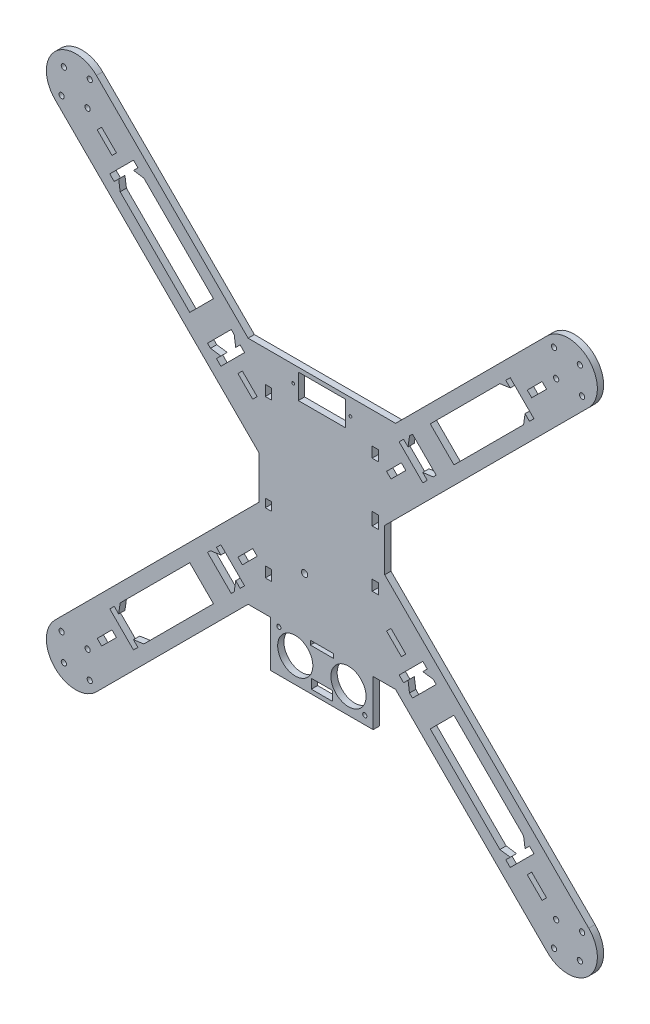
from build123d import *

# Parameters (mm, degrees)
BOSS_EXTRUDE1_DEPTH = 3
SKETCH4_R           = 1.25
CUT_EXTRUDE1_DEPTH  = 3
SKETCH5_R           = 0.65
SKETCH5_W           = 22.5
SKETCH5_H           = 11.8
CUT_EXTRUDE2_DEPTH  = 3
SKETCH6_R           = 1.5
CUT_EXTRUDE3_DEPTH  = 3
SKETCH7_R           = 1
SKETCH7_R_2         = 8.4
SKETCH7_W           = 11
SKETCH7_H           = 2
SKETCH7_W_2         = 10
SKETCH7_H_2         = 4.5
CUT_EXTRUDE4_DEPTH  = 3
CUT_EXTRUDE5_DEPTH  = 186.993279448
BOSS_EXTRUDE2_REACH = 195.992
SKETCH9_W           = 3
SKETCH9_H           = 12
BOSS_EXTRUDE3_REACH = 195.992
SKETCH11_W          = 3
SKETCH11_H          = 12
BOSS_EXTRUDE4_REACH = 195.992
SKETCH12_W          = 3
SKETCH12_H          = 12
BOSS_EXTRUDE5_REACH = 195.992
SKETCH13_W          = 3
SKETCH13_H          = 12
SKETCH14_W          = 3
SKETCH14_H          = 6
SKETCH14_H_2        = 5
SKETCH14_H_3        = 4
CUT_EXTRUDE6_DEPTH  = 186.993279448


with BuildPart() as part:
    # Sketch1 → Boss-Extrude1 (new body)
    with BuildSketch(Plane.XY):
        with BuildLine():
            Line((35.201010127, 55), (-35.201010127, 55))
            Line((-35.201010127, 55), (-107.600505063, 127.399494937))
            ThreePointArc((-107.600505063, 127.399494937), (-127.399494937, 127.399494937), (-127.399494937, 107.600505063))
            Line((-127.399494937, 107.600505063), (-30, 10.201010127))
            Line((-30, 10.201010127), (-30, -10.201010127))
            Line((-30, -10.201010127), (-127.399494937, -107.600505063))
            ThreePointArc((-127.399494937, -107.600505063), (-127.399494937, -127.399494937), (-107.600505063, -127.399494937))
            Line((-107.600505063, -127.399494937), (-35.201010127, -55))
            Line((-35.201010127, -55), (-24.5, -55))
            Line((-24.5, -55), (-24.5, -77))
            Line((-24.5, -77), (24.5, -77))
            Line((24.5, -77), (24.5, -55))
            Line((24.5, -55), (35.201010127, -55))
            Line((35.201010127, -55), (107.600505063, -127.399494937))
            ThreePointArc((107.600505063, -127.399494937), (127.399494937, -127.399494937), (127.399494937, -107.600505063))
            Line((127.399494937, -107.600505063), (30, -10.201010127))
            Line((30, -10.201010127), (30, 10.201010127))
            Line((30, 10.201010127), (127.399494937, 107.600505063))
            ThreePointArc((127.399494937, 107.600505063), (127.399494937, 127.399494937), (107.600505063, 127.399494937))
            Line((107.600505063, 127.399494937), (35.201010127, 55))
        make_face()
    extrude(amount=-BOSS_EXTRUDE1_DEPTH)

    # Sketch4 → Cut-Extrude1 (cut)
    with BuildSketch(Plane.XY):
        with Locations((-110.782485579, 124.217514421)):
            Circle(SKETCH4_R)
        with Locations((-124.217514421, 110.782485579)):
            Circle(SKETCH4_R)
        with Locations((-123.156854249, 123.156854249)):
            Circle(SKETCH4_R)
        with Locations((-111.843145751, 111.843145751)):
            Circle(SKETCH4_R)
        with Locations((111.843145751, 111.843145751)):
            Circle(SKETCH4_R)
        with Locations((110.782485579, 124.217514421)):
            Circle(SKETCH4_R)
        with Locations((123.156854249, 123.15685425)):
            Circle(SKETCH4_R)
        with Locations((124.217514421, 110.782485579)):
            Circle(SKETCH4_R)
        with Locations((111.843145751, -111.84314575)):
            Circle(SKETCH4_R)
        with Locations((124.217514421, -110.782485579)):
            Circle(SKETCH4_R)
        with Locations((123.15685425, -123.156854249)):
            Circle(SKETCH4_R)
        with Locations((110.782485579, -124.217514421)):
            Circle(SKETCH4_R)
        with Locations((-111.84314575, -111.843145751)):
            Circle(SKETCH4_R)
        with Locations((-110.782485579, -124.217514421)):
            Circle(SKETCH4_R)
        with Locations((-123.156854249, -123.156854249)):
            Circle(SKETCH4_R)
        with Locations((-124.217514421, -110.782485579)):
            Circle(SKETCH4_R)
    extrude(amount=-CUT_EXTRUDE1_DEPTH, mode=Mode.SUBTRACT)

    # Sketch5 → Cut-Extrude2 (cut)
    with BuildSketch(Plane.XY):
        with Locations((-13.65, 47.1)):
            Circle(SKETCH5_R)
        with Locations((13.65, 47.1)):
            Circle(SKETCH5_R)
        with Locations((0, 47.1)):
            Rectangle(SKETCH5_W, SKETCH5_H)
    extrude(amount=-CUT_EXTRUDE2_DEPTH, mode=Mode.SUBTRACT)

    # Sketch6 → Cut-Extrude3 (cut)
    with BuildSketch(Plane.XY):
        with Locations((-8.25, -28.8)):
            Circle(SKETCH6_R)
    extrude(amount=-CUT_EXTRUDE3_DEPTH, mode=Mode.SUBTRACT)

    # Sketch7 → Cut-Extrude4 (cut)
    with BuildSketch(Plane.XY):
        with Locations((-20.5, -57)):
            Circle(SKETCH7_R)
        with Locations((-12.7, -65)):
            Circle(SKETCH7_R_2)
        with Locations((12.7, -65)):
            Circle(SKETCH7_R_2)
        with Locations((20.5, -73)):
            Circle(SKETCH7_R)
        with Locations((0, -56)):
            Rectangle(SKETCH7_W, SKETCH7_H)
        with Locations((0, -72.75)):
            Rectangle(SKETCH7_W_2, SKETCH7_H_2)
    extrude(amount=-CUT_EXTRUDE4_DEPTH, mode=Mode.SUBTRACT)

    # Sketch8 → Cut-Extrude5 (cut, through all)
    with BuildSketch(Plane.XY):
        Polygon((101.236544033, -89.922835534), (89.922835534, -101.236544033), (87.80151519, -99.115223689), (89.922835534, -96.993903346), (84.973088065, -96.286796564), (41.839574413, -53.153282912), (41.132467632, -48.203535444), (39.011147288, -50.324855787), (36.889826945, -48.203535444), (48.203535444, -36.889826945), (50.324855787, -39.011147288), (48.203535444, -41.132467632), (53.153282912, -41.839574413), (96.286796564, -84.973088065), (96.993903346, -89.922835534), (99.115223689, -87.80151519), align=None)
        Polygon((40.07180746, -37.950487117), (37.950487117, -40.07180746), (30.879419305, -33.000739648), (33.000739648, -30.879419305), align=None)
        Polygon((50.324855787, 39.011147288), (48.203535444, 36.889826945), (36.889826945, 48.203535444), (39.011147288, 50.324855787), (41.132467632, 48.203535444), (41.839574413, 53.153282912), (84.973088065, 96.286796564), (89.922835534, 96.993903346), (87.80151519, 99.115223689), (89.922835534, 101.236544033), (101.236544033, 89.922835534), (99.115223689, 87.80151519), (96.993903346, 89.922835534), (96.286796564, 84.973088065), (53.153282912, 41.839574413), (48.142875272, 41.193127804), align=None)
        Polygon((100.175883861, -98.054563517), (98.054563517, -100.175883861), (105.125631329, -107.246951673), (107.246951673, -105.125631329), align=None)
        Polygon((-101.236544033, -89.922835534), (-99.115223689, -87.80151519), (-96.993903346, -89.922835534), (-96.286796564, -84.973088065), (-53.153282912, -41.839574413), (-48.203535444, -41.132467632), (-50.324855787, -39.011147288), (-48.203535444, -36.889826945), (-36.889826945, -48.203535444), (-39.011147288, -50.324855787), (-41.132467632, -48.203535444), (-41.839574413, -53.153282912), (-84.973088065, -96.286796564), (-89.922835534, -96.993903346), (-87.80151519, -99.115223689), (-89.922835534, -101.236544033), align=None)
        Polygon((-100.175883861, -98.054563517), (-107.246951673, -105.125631329), (-105.125631329, -107.246951673), (-98.054563517, -100.175883861), align=None)
        Polygon((-37.950487117, -40.07180746), (-40.07180746, -37.950487117), (-33.000739648, -30.879419305), (-30.879419305, -33.000739648), align=None)
        Polygon((-89.922835534, 101.236544033), (-87.80151519, 99.115223689), (-89.922835534, 96.993903346), (-84.973088065, 96.286796564), (-41.839574413, 53.153282912), (-41.132467632, 48.203535444), (-39.011147288, 50.324855787), (-36.889826945, 48.203535444), (-48.203535444, 36.889826945), (-50.324855787, 39.011147288), (-48.203535444, 41.132467632), (-53.153282912, 41.839574413), (-96.286796564, 84.973088065), (-96.993903346, 89.922835534), (-99.115223689, 87.80151519), (-101.236544033, 89.922835534), align=None)
        Polygon((-98.054563517, 100.175883861), (-105.125631329, 107.246951673), (-107.246951673, 105.125631329), (-100.175883861, 98.054563517), align=None)
        Polygon((-40.07180746, 37.950487117), (-37.950487117, 40.07180746), (-30.879419305, 33.000739648), (-33.000739648, 30.879419305), align=None)
        Polygon((100.175883861, 98.054563517), (107.246951673, 105.125631329), (105.125631329, 107.246951673), (98.054563517, 100.175883861), align=None)
        Polygon((37.950487117, 40.07180746), (40.07180746, 37.950487117), (33.000739648, 30.879419305), (30.879419305, 33.000739648), align=None)
    extrude(amount=-CUT_EXTRUDE5_DEPTH, mode=Mode.SUBTRACT)

    # Sketch9 → Boss-Extrude2 (add, up to next)
    with BuildSketch(Plane(origin=(-5.656854249, 5.656854249, 0), x_dir=(0, 0, -1), z_dir=(0.70710678118654, -0.707106781186555, 0)), mode=Mode.PRIVATE) as boss_extrude2_sk1:
        with Locations((1.5, 75.170093579)):
            Rectangle(SKETCH9_W, SKETCH9_H)
    boss_extrude2_tool1 = extrude(boss_extrude2_sk1.sketch, amount=BOSS_EXTRUDE2_REACH, mode=Mode.PRIVATE) - part.part
    add(boss_extrude2_tool1.solids().sort_by_distance((47.496429, 58.810137, -1.5))[0])

    # Sketch11 → Boss-Extrude3 (add, up to next)
    with BuildSketch(Plane(origin=(5.656854249, 5.656854249, 0), x_dir=(0, 0, 1), z_dir=(-0.7071067811865477, -0.7071067811865475, 0)), mode=Mode.PRIVATE) as boss_extrude3_sk1:
        with Locations((-1.5, -75.170093579)):
            Rectangle(SKETCH11_W, SKETCH11_H)
    boss_extrude3_tool1 = extrude(boss_extrude3_sk1.sketch, amount=BOSS_EXTRUDE3_REACH, mode=Mode.PRIVATE) - part.part
    add(boss_extrude3_tool1.solids().sort_by_distance((58.810137, -47.496429, -1.5))[0])

    # Sketch12 → Boss-Extrude4 (add, up to next)
    with BuildSketch(Plane(origin=(5.656854249, -5.656854249, 0), x_dir=(0, 0, 1), z_dir=(-0.7071067811865449, 0.7071067811865502, 0)), mode=Mode.PRIVATE) as boss_extrude4_sk1:
        with Locations((-1.5, -75.170093579)):
            Rectangle(SKETCH12_W, SKETCH12_H)
    boss_extrude4_tool1 = extrude(boss_extrude4_sk1.sketch, amount=BOSS_EXTRUDE4_REACH, mode=Mode.PRIVATE) - part.part
    add(boss_extrude4_tool1.solids().sort_by_distance((-47.496429, -58.810137, -1.5))[0])

    # Sketch13 → Boss-Extrude5 (add, up to next)
    with BuildSketch(Plane(origin=(5.656854249, 5.656854249, 0), x_dir=(0, 0, 1), z_dir=(-0.707106781186552, -0.707106781186543, 0)), mode=Mode.PRIVATE) as boss_extrude5_sk1:
        with Locations((-1.5, 75.170093579)):
            Rectangle(SKETCH13_W, SKETCH13_H)
    boss_extrude5_tool1 = extrude(boss_extrude5_sk1.sketch, amount=BOSS_EXTRUDE5_REACH, mode=Mode.PRIVATE) - part.part
    add(boss_extrude5_tool1.solids().sort_by_distance((-47.496429, 58.810137, -1.5))[0])

    # Sketch14 → Cut-Extrude6 (cut, through all)
    with BuildSketch(Plane(origin=(0, 0, -3), x_dir=(-1, 0, 0), z_dir=(0, 0, -1))):
        with Locations((-25.5, 10)):
            Rectangle(SKETCH14_W, SKETCH14_H)
        with Locations((25.5, -37.5)):
            Rectangle(SKETCH14_W, SKETCH14_H_2)
        with Locations((25.5, -9)):
            Rectangle(SKETCH14_W, SKETCH14_H_3)
        with Locations((25.5, 37.5)):
            Rectangle(SKETCH14_W, SKETCH14_H_2)
        with Locations((-25.5, -17.5)):
            Rectangle(SKETCH14_W, SKETCH14_H_2)
        with Locations((-25.5, 37.5)):
            Rectangle(SKETCH14_W, SKETCH14_H_2)
    extrude(amount=-CUT_EXTRUDE6_DEPTH, mode=Mode.SUBTRACT)


solid = part.part
